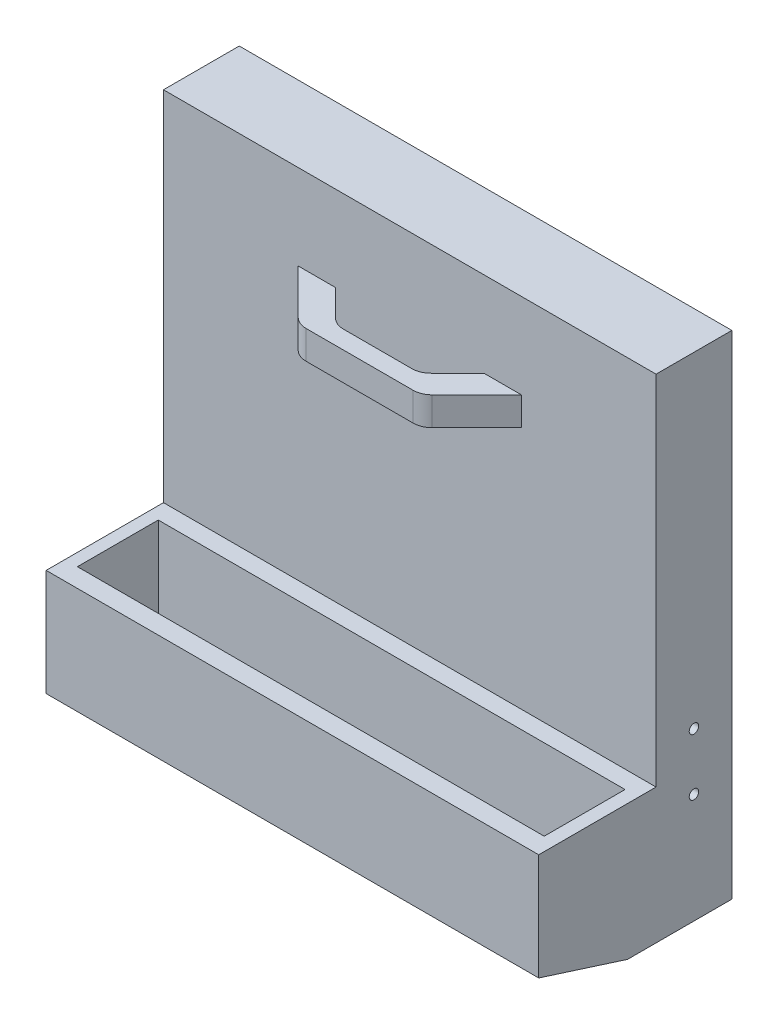
from build123d import *

# Parameters (mm, degrees)
SKETCH1_W           = 330.2
SKETCH1_H           = 330.2
BOSS_EXTRUDE1_DEPTH = 50.8
BOSS_EXTRUDE2_START = 254
BOSS_EXTRUDE2_DEPTH = 19.05
SHELL1_START        = 6.35
SHELL1_OUTLINE_W    = 317.5
SHELL1_OUTLINE_H    = 44.45
SHELL1_DEPTH        = 317.5
SHELL1_START_2      = 260.35
SHELL1_2_DEPTH      = 6.35
SKETCH3_R           = 3.175
CUT_EXTRUDE1_DEPTH  = 475.544431862
BOSS_EXTRUDE3_DEPTH = 330.2
SKETCH5_W           = 312.91275174
SKETCH5_H           = 54.204225569
CUT_EXTRUDE2_DEPTH  = 68.58


# Read off the part's stored shape, not the designer's step: Shell1
with BuildPart() as part:
    # Sketch1 → Boss-Extrude1 (new body)
    with BuildSketch(Plane.XY):
        with Locations((165.1, 165.1)):
            Rectangle(SKETCH1_W, SKETCH1_H)
    extrude(amount=BOSS_EXTRUDE1_DEPTH)

    # Sketch2 → Boss-Extrude2 (add)
    with BuildSketch(Plane(origin=(0, 0, 0), x_dir=(1, 0, 0), z_dir=(0, 1, 0)).offset(BOSS_EXTRUDE2_START)):
        with BuildLine():
            Line((142.104085231, -72.303901903), (188.095914769, -72.303901903))
            ThreePointArc((188.095914769, -72.303901903), (192.95599436, -71.337171966), (197.07617089, -68.584158024))
            Line((197.07617089, -68.584158024), (214.860328914, -50.8))
            Line((214.860328914, -50.8), (239.897502761, -50.8))
            Line((239.897502761, -50.8), (209.987762385, -80.709740376))
            ThreePointArc((209.987762385, -80.709740376), (205.867585855, -83.462754317), (201.007506264, -84.429484254))
            Line((201.007506264, -84.429484254), (129.192493736, -84.429484254))
            ThreePointArc((129.192493736, -84.429484254), (124.332414145, -83.462754317), (120.212237615, -80.709740376))
            Line((120.212237615, -80.709740376), (90.302497239, -50.8))
            Line((90.302497239, -50.8), (115.339671086, -50.8))
            Line((115.339671086, -50.8), (133.12382911, -68.584158024))
            ThreePointArc((133.12382911, -68.584158024), (137.24400564, -71.337171966), (142.104085231, -72.303901903))
        make_face()
    extrude(amount=BOSS_EXTRUDE2_DEPTH)

    # Shell1 outline → Shell1 (cut)
    with BuildSketch(Plane(origin=(0, 0, 0), x_dir=(1, 0, 0), z_dir=(0, 1, 0)).offset(SHELL1_START)):
        with Locations((165.1, -22.225)):
            Rectangle(SHELL1_OUTLINE_W, SHELL1_OUTLINE_H)
    extrude(amount=SHELL1_DEPTH, mode=Mode.SUBTRACT)

    # Shell1 2 outline → Shell1 2 (cut)
    with BuildSketch(Plane(origin=(0, 0, 0), x_dir=(1, 0, 0), z_dir=(0, 1, 0)).offset(SHELL1_START_2)):
        with BuildLine():
            Line((192.738689455, -78.079484254), (201.007506264, -78.079484254))
            ThreePointArc((201.007506264, -78.079484254), (203.43754606, -77.596119286), (205.497634325, -76.219612315))
            Line((205.497634325, -76.219612315), (237.26724664, -44.45))
            Line((237.26724664, -44.45), (230.190585035, -44.45))
            Line((230.190585035, -44.45), (201.56629895, -73.074286085))
            ThreePointArc((201.56629895, -73.074286085), (197.491905042, -76.1755001), (192.738689455, -78.079484254))
        make_face()
        with BuildLine():
            Line((128.63370105, -73.074286085), (100.009414965, -44.45))
            Line((100.009414965, -44.45), (92.93275336, -44.45))
            Line((92.93275336, -44.45), (124.702365675, -76.219612315))
            ThreePointArc((124.702365675, -76.219612315), (126.76245394, -77.596119286), (129.192493736, -78.079484254))
            Line((129.192493736, -78.079484254), (137.461310545, -78.079484254))
            ThreePointArc((137.461310545, -78.079484254), (132.708094958, -76.1755001), (128.63370105, -73.074286085))
        make_face()
    extrude(amount=SHELL1_2_DEPTH, mode=Mode.SUBTRACT)

    # Sketch3 → Cut-Extrude1 (cut, through all)
    with BuildSketch(Plane.ZY):
        with Locations((25.4, 111.6816843)):
            Circle(SKETCH3_R)
        with Locations((25.4, 73.5816843)):
            Circle(SKETCH3_R)
    extrude(amount=-CUT_EXTRUDE1_DEPTH, mode=Mode.SUBTRACT)

    # Sketch4 → Boss-Extrude3 (add)
    with BuildSketch(Plane.ZY):
        Polygon((50.8, 0), (69.908855574, 0), (129.44460093, 18.967737852), (129.44460093, 90.50525308), (50.8, 90.50525308), align=None)
    extrude(amount=-BOSS_EXTRUDE3_DEPTH)

    # Sketch5 → Cut-Extrude2 (cut)
    with BuildSketch(Plane(origin=(0, 90.50525308, 0), x_dir=(1, 0, 0), z_dir=(0, 1, 0))):
        with Locations((164.794269249, -89.730963472)):
            Rectangle(SKETCH5_W, SKETCH5_H)
    extrude(amount=-CUT_EXTRUDE2_DEPTH, mode=Mode.SUBTRACT)


solid = part.part
